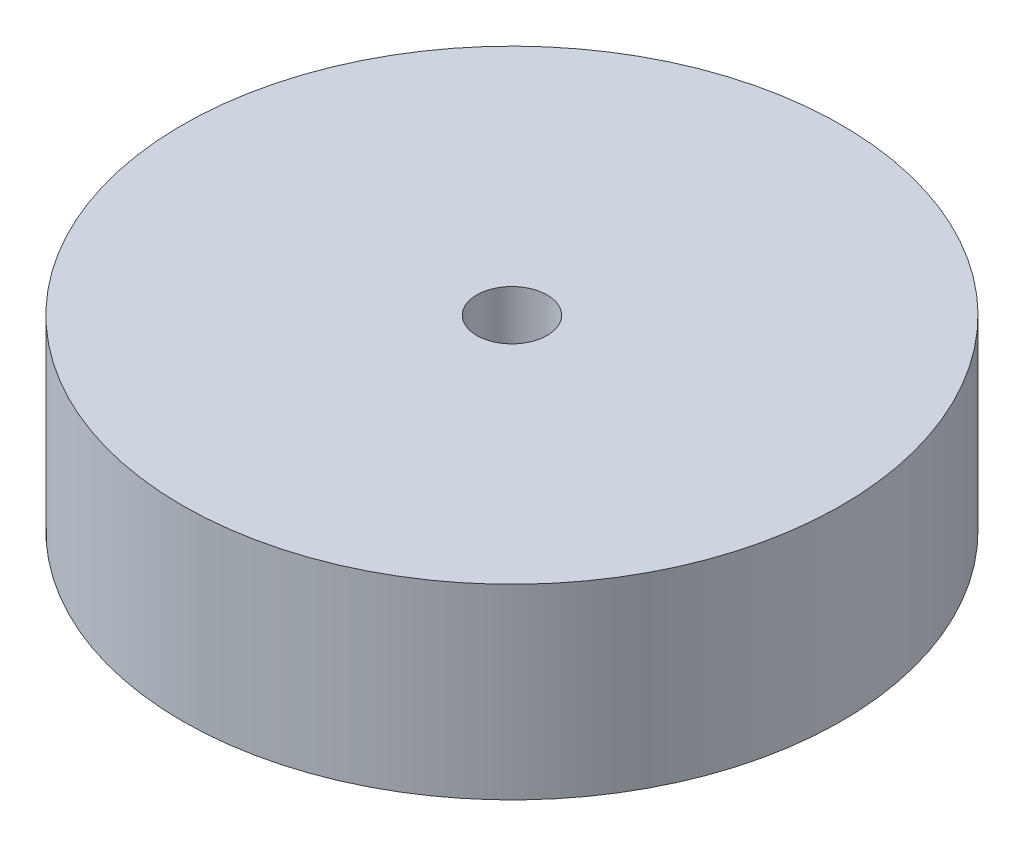
from build123d import *

# Parameters (mm, degrees)
SKETCH1_R           = 15
SKETCH1_R_2         = 1.6
BOSS_EXTRUDE1_DEPTH = 8.5


with BuildPart() as part:
    # Sketch1 → Boss-Extrude1 (new body)
    with BuildSketch(Plane(origin=(0, 0, 0), x_dir=(1, 0, 0), z_dir=(0, 1, 0))):
        Circle(SKETCH1_R)
        Circle(SKETCH1_R_2, mode=Mode.SUBTRACT)
    extrude(amount=BOSS_EXTRUDE1_DEPTH)


solid = part.part
